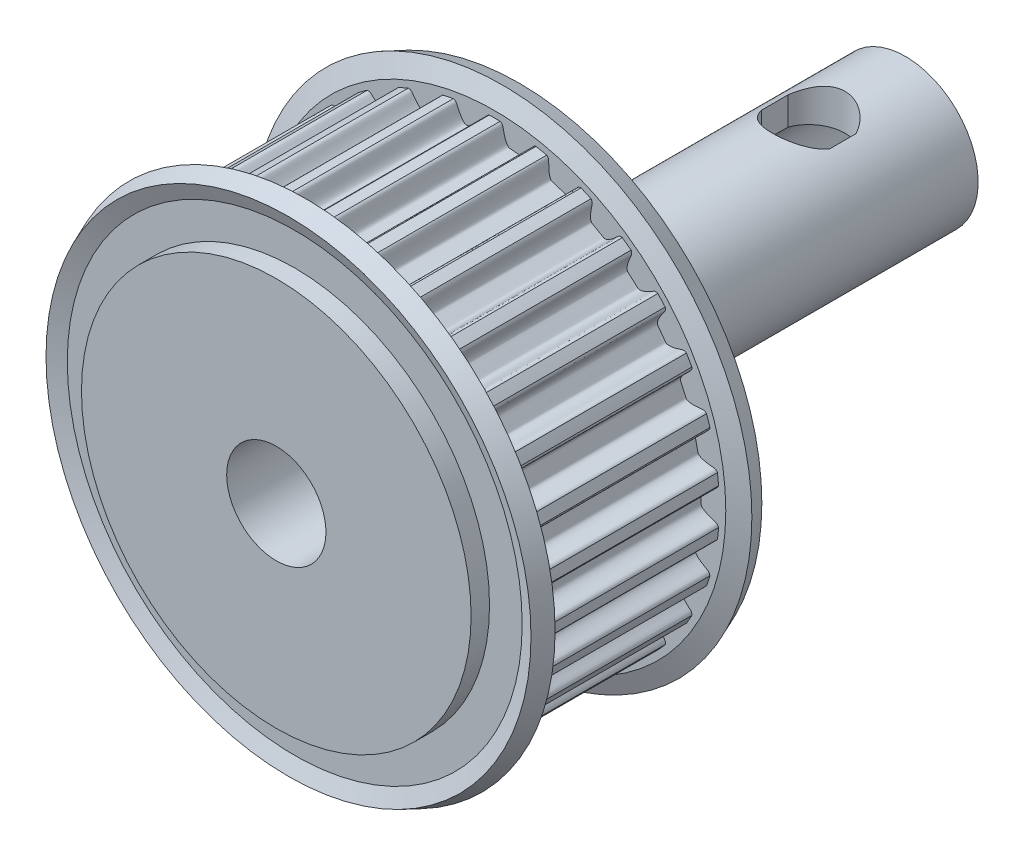
from build123d import *

# Parameters (mm, degrees)
TOOTHEXTRUDECUTGEARBELT01_DEPTH = 3.749999944
TOOTH_PATTERN_30_COUNT          = 30
BOREREVOLVESKETCH_W             = 10.547999842
BOREREVOLVESKETCH_H             = 5
SKETCH_5_R                      = 5
EXTRUDE_1_DEPTH                 = 11
SKETCH_6_R                      = 3.15
SKETCH_6_R_2                    = 2.05
EXTRUDE_3_DEPTH                 = 15
CUT_EXTRUDE_START               = -15
SKETCH_8_R                      = 2.05
CUT_EXTRUDE_2_DEPTH             = 15
EXTRUDE_START                   = -25
EXTRUDE_4_DEPTH                 = 25
CUT_EXTRUDE_3_DEPTH             = 25
SKETCH_11_R                     = 3.15
SKETCH_11_R_2                   = 3
CUT_EXTRUDE_4_DEPTH             = 15


with BuildPart() as part:
    # SketchRevolveGearBelt01 → Gates_PowerGrip_GT_2mm, 6mm Belt Width (revolve)
    with BuildSketch(Plane(origin=(0, 0, 0), x_dir=(0, 0, -1), z_dir=(1, 0, 0))):
        Polygon((5.273999921, 0), (5.273999921, 8.049296465), (4.511999932, 8.049296465), (4.511999932, 9.39772522), (4.769626867, 10.01969166), (4.065630673, 10.311296431), (3.749999944, 9.549296442), (3.749999944, 9.280480626), (-3.749999944, 9.280480626), (-3.749999944, 9.549296442), (-4.065630673, 10.311296431), (-4.769626867, 10.01969166), (-4.511999932, 9.39772522), (-4.511999932, 8.049296465), (-5.273999921, 8.049296465), (-5.273999921, 0), align=None)
    revolve(axis=Axis((0, 0, 0), (0, 0, -1)))

    # SketchToothGearBelt01 → ToothExtrudeCutGearBelt01 (cut, symmetric)
    with BuildSketch(Plane.XY):
        with BuildLine():
            ThreePointArc((9.259469869, 0.812097889), (9.295013999, 0), (9.259469869, -0.812097889))
            add(Edge.make_bspline(
                [(9.259469869, -0.812097889), (9.259882643, -0.798926426), (9.258535745, -0.779109129), (9.252881928, -0.753334284), (9.246755053, -0.734515852), (9.238801169, -0.716393821), (9.229098, -0.699145002), (9.217740163, -0.682937939), (9.204838756, -0.667930081), (9.190518793, -0.65427062), (9.174923394, -0.642082736), (9.158192233, -0.631523205), (9.140535394, -0.622553924), (9.096806178, -0.606636992), (9.040654354, -0.589254035), (8.974000339, -0.567478509), (8.923234955, -0.549822047), (8.875536871, -0.532182767), (8.830912224, -0.514541632), (8.789358436, -0.496903406), (8.750874778, -0.479266882), (8.715459684, -0.46163211), (8.68311132, -0.443998471), (8.653827322, -0.426364888), (8.627604868, -0.408729361), (8.604440496, -0.39108843), (8.584331378, -0.373436343), (8.567273563, -0.355764081), (8.553273739, -0.338058507), (8.542322401, -0.320303478), (8.534501566, -0.302483729), (8.529637264, -0.284599108), (8.527464323, -0.250294946), (8.531227193, -0.199977901), (8.531655597, -0.133284358), (8.532656984, -0.066646885), (8.532835685, 0), (8.532656984, 0.066646885), (8.531655597, 0.133284358), (8.531227193, 0.199977901), (8.527464323, 0.250294946), (8.529637264, 0.284599108), (8.534501566, 0.302483729), (8.542322401, 0.320303478), (8.553273739, 0.338058507), (8.567273563, 0.355764081), (8.584331378, 0.373436343), (8.604440496, 0.39108843), (8.627604868, 0.408729361), (8.653827322, 0.426364888), (8.68311132, 0.443998471), (8.715459684, 0.46163211), (8.750874778, 0.479266882), (8.789358436, 0.496903406), (8.830912224, 0.514541632), (8.875536871, 0.532182767), (8.923234955, 0.549822047), (8.974000339, 0.567478509), (9.040654354, 0.589254035), (9.096806178, 0.606636992), (9.140535394, 0.622553924), (9.158192233, 0.631523205), (9.174923394, 0.642082736), (9.190518793, 0.65427062), (9.204838756, 0.667930081), (9.217740163, 0.682937939), (9.229098, 0.699145002), (9.238801169, 0.716393821), (9.246755053, 0.734515852), (9.252881928, 0.753334284), (9.258535745, 0.779109129), (9.259882643, 0.798926426), (9.259469869, 0.812097889)],
                knots=[0, 0, 0, 0, 0.015923832, 0.023885748, 0.031847664, 0.039809581, 0.047771497, 0.055733413, 0.063695329, 0.071657245, 0.079619161, 0.087581077, 0.095542993, 0.10350491, 0.143783134, 0.166612007, 0.18826668, 0.208754844, 0.228085578, 0.246269698, 0.263320202, 0.279252862, 0.294087016, 0.307846634, 0.320561765, 0.332270503, 0.343021643, 0.352878214, 0.361921967, 0.370258601, 0.378022746, 0.385380527, 0.392526466, 0.419432991, 0.44628866, 0.47314433, 0.5, 0.52685567, 0.55371134, 0.580567009, 0.607473534, 0.614619473, 0.621977254, 0.629741399, 0.638078033, 0.647121786, 0.656978357, 0.667729497, 0.679438235, 0.692153366, 0.705912984, 0.720747138, 0.736679798, 0.753730302, 0.771914422, 0.791245156, 0.81173332, 0.833387993, 0.856216866, 0.89649509, 0.904457007, 0.912418923, 0.920380839, 0.928342755, 0.936304671, 0.944266587, 0.952228503, 0.960190419, 0.968152336, 0.976114252, 0.984076168, 1, 1, 1, 1], degree=3))
        make_face()
    toothextrudecutgearbelt01 = extrude(amount=TOOTHEXTRUDECUTGEARBELT01_DEPTH, both=True, mode=Mode.SUBTRACT)

    # Tooth Pattern, 30: ToothExtrudeCutGearBelt01 ×30 about axis
    tooth_pattern_30_axis = Axis((0, 0, 55), (0, 0, -1))
    for i in range(1, TOOTH_PATTERN_30_COUNT):
        add(toothextrudecutgearbelt01.rotate(tooth_pattern_30_axis, i * 360 / TOOTH_PATTERN_30_COUNT), mode=Mode.SUBTRACT)

    # BoreRevolveSketch → BoreRevolveCut (revolve, cut)
    with BuildSketch(Plane(origin=(0, 0, 0), x_dir=(0, 0, -1), z_dir=(1, 0, 0))):
        with Locations((0, 2.5)):
            Rectangle(BOREREVOLVESKETCH_W, BOREREVOLVESKETCH_H)
    revolve(axis=Axis((0, 0, 0), (0, 0, -1)), mode=Mode.SUBTRACT)

    # 草图5 → 凸台-拉伸1 (add)
    with BuildSketch(Plane.XY.offset(5.273999921)):
        Circle(SKETCH_5_R)
    extrude(amount=-EXTRUDE_1_DEPTH)

    # 草图6 → 凸台-拉伸3 (add)
    with BuildSketch(Plane(origin=(0, 0, -5.726000079), x_dir=(-1, 0, 0), z_dir=(0, 0, -1))):
        Circle(SKETCH_6_R)
        Circle(SKETCH_6_R_2, mode=Mode.SUBTRACT)
    extrude(amount=EXTRUDE_3_DEPTH)

    # 草图8 → 切除-拉伸2 (cut)
    with BuildSketch(Plane(origin=(0, 0, -5.726000079), x_dir=(-1, 0, 0), z_dir=(0, 0, -1)).offset(CUT_EXTRUDE_START)):
        Circle(SKETCH_8_R)
    extrude(amount=CUT_EXTRUDE_2_DEPTH, mode=Mode.SUBTRACT)

    # 草图9 → 凸台-拉伸4 (add)
    with BuildSketch(Plane(origin=(0, 0, -20.726000079), x_dir=(-1, 0, 0), z_dir=(0, 0, -1)).offset(EXTRUDE_START)):
        with BuildLine():
            ThreePointArc((1.397318861, 1.5), (0, 2.05), (-1.397318861, 1.5))
            Line((-1.397318861, 1.5), (0, 1.5))
            Line((0, 1.5), (1.397318861, 1.5))
        make_face()
    extrude(amount=EXTRUDE_4_DEPTH)

    # 草图10 → 切除-拉伸3 (cut)
    with BuildSketch(Plane.XZ.offset(-1.5)):
        with BuildLine():
            Line((1.397318861, -17.271435685), (1.397318861, -16.180564473))
            ThreePointArc((1.397318861, -16.180564473), (0, -15.226000079), (-1.397318861, -16.180564473))
            Line((-1.397318861, -16.180564473), (-1.397318861, -17.271435685))
            ThreePointArc((-1.397318861, -17.271435685), (-0.846122506, -17.964578581), (0, -18.226000079))
            ThreePointArc((0, -18.226000079), (0.846122506, -17.964578581), (1.397318861, -17.271435685))
        make_face()
    extrude(amount=-CUT_EXTRUDE_3_DEPTH, mode=Mode.SUBTRACT)

    # 草图11 → 切除-拉伸4 (cut)
    with BuildSketch(Plane(origin=(0, 0, -20.726000079), x_dir=(-1, 0, 0), z_dir=(0, 0, -1)).offset(CUT_EXTRUDE_START)):
        Circle(SKETCH_11_R)
        Circle(SKETCH_11_R_2, mode=Mode.SUBTRACT)
    extrude(amount=CUT_EXTRUDE_4_DEPTH, mode=Mode.SUBTRACT)


solid = part.part
